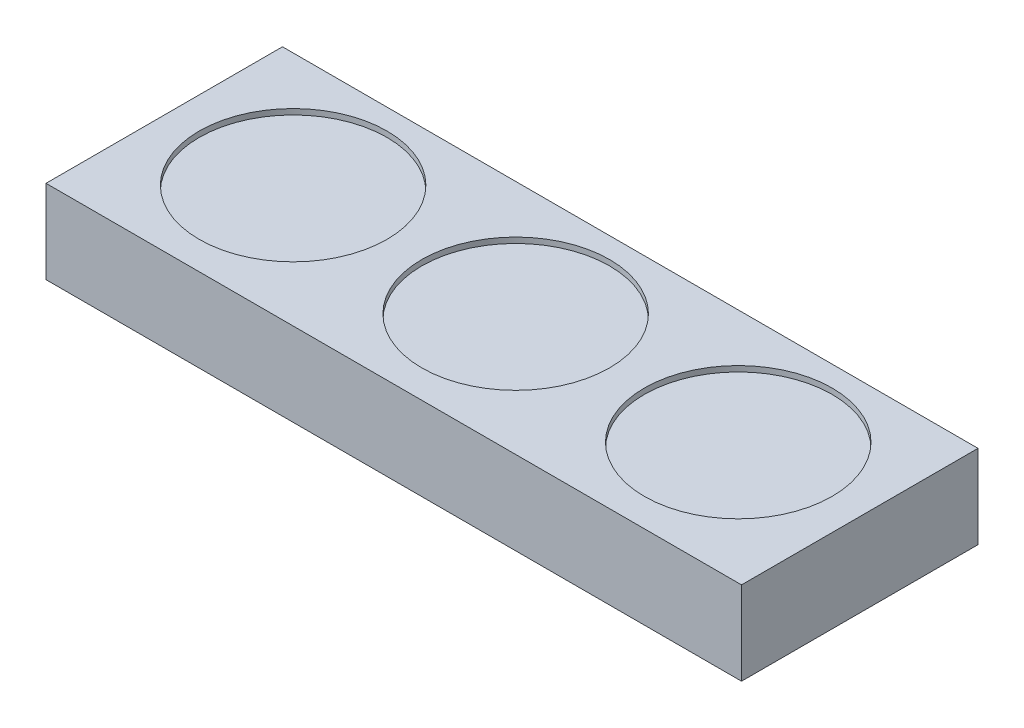
from build123d import *

# Parameters (mm, degrees)
SKETCH1_W           = 500
SKETCH1_H           = 170
BOSS_EXTRUDE1_DEPTH = 60
SKETCH3_R           = 67.5
CUT_EXTRUDE1_DEPTH  = 4


with BuildPart() as part:
    # Sketch1 → Boss-Extrude1 (new body)
    with BuildSketch(Plane(origin=(0, 0, 0), x_dir=(1, 0, 0), z_dir=(0, 1, 0))):
        with Locations((-5.514705882, 23.455882353)):
            Rectangle(SKETCH1_W, SKETCH1_H)
    extrude(amount=BOSS_EXTRUDE1_DEPTH)

    # Sketch3 → Cut-Extrude1 (cut)
    with BuildSketch(Plane(origin=(0, 60, 0), x_dir=(1, 0, 0), z_dir=(0, 1, 0))):
        with Locations((-5.514705882, 26.094123359)):
            Circle(SKETCH3_R)
        with Locations((154.485294118, 26.094123359)):
            Circle(SKETCH3_R)
        with Locations((-165.514705882, 26.094123359)):
            Circle(SKETCH3_R)
    extrude(amount=-CUT_EXTRUDE1_DEPTH, mode=Mode.SUBTRACT)


solid = part.part
